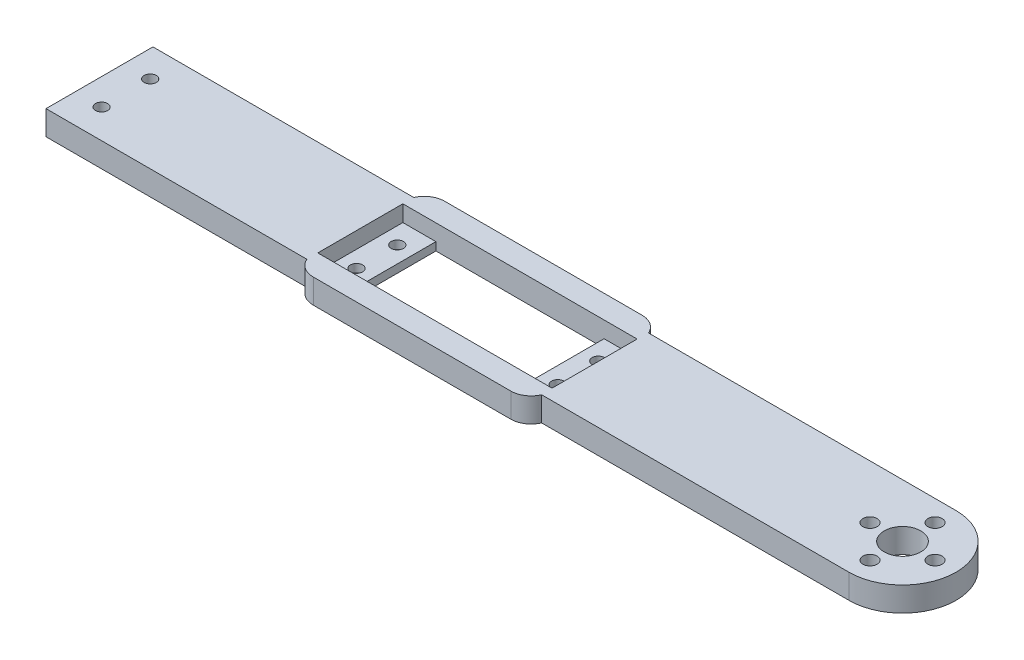
from build123d import *

# Parameters (mm, degrees)
SKETCH1_W            = 57.629592668
SKETCH1_H            = 21.211867522
SKETCH1_R            = 1.75
SKETCH1_R_2          = 4.5
BOSS_EXTRUDE1_DEPTH  = 6
SKETCH1_22_W         = 8.129592668
SKETCH1_22_H         = 21.211867522
SKETCH1_22_R         = 1.5
BOSS_EXTRUDE2_DEPTH  = 2
SKETCH4_W            = 57.748953374
SKETCH4_H            = 6
BOSS_EXTRUDE4_DEPTH  = 3
FILLET2_R            = 5
FILLET2_OF_MIRROR1_R = 5
SKETCH8_R            = 1.5
CUT_EXTRUDE4_DEPTH   = 13


with BuildPart() as part:
    # Sketch1 → Boss-Extrude1 (new body)
    with BuildSketch(Plane(origin=(0, 0, 0), x_dir=(1, 0, 0), z_dir=(0, 1, 0))):
        with BuildLine():
            Line((-197.556308439, -13.154372872), (0, -13.154372872))
            ThreePointArc((0, -13.154372872), (13.154372872, 0), (0, 13.154372872))
            Line((0, 13.154372872), (-197.556308439, 13.154372872))
            Line((-197.556308439, 13.154372872), (-197.556308439, -13.154372872))
        make_face()
        with Locations((-104.57172107, -0.139435446)):
            Rectangle(SKETCH1_W, SKETCH1_H, mode=Mode.SUBTRACT)
        with Locations(Location((0, 8, 0), (0, 0, 270))):
            Circle(SKETCH1_R, mode=Mode.SUBTRACT)
        with Locations(Location((0, -8, 0), (0, 0, 270))):
            Circle(SKETCH1_R, mode=Mode.SUBTRACT)
        with Locations(Location((-8, 0, 0), (0, 0, 270))):
            Circle(SKETCH1_R, mode=Mode.SUBTRACT)
        with Locations(Location((0, 0, 0), (0, 0, 270))):
            Circle(SKETCH1_R_2, mode=Mode.SUBTRACT)
        with Locations(Location((8, 0, 0), (0, 0, 270))):
            Circle(SKETCH1_R, mode=Mode.SUBTRACT)
    boss_extrude1 = extrude(amount=BOSS_EXTRUDE1_DEPTH)

    # Sketch1<22> → Boss-Extrude2 (add)
    # profile 1 of 2: a face of its own
    with BuildSketch(Plane(origin=(0, 0, 0), x_dir=(1, 0, 0), z_dir=(0, 1, 0))):
        with Locations((-129.32172107, -0.139435446)):
            Rectangle(SKETCH1_22_W, SKETCH1_22_H)
        with Locations(Location((-129.32172107, -5, 0), (0, 0, 270))):
            Circle(SKETCH1_22_R, mode=Mode.SUBTRACT)
        with Locations(Location((-129.29672107, 5, 0), (0, 0, 270))):
            Circle(SKETCH1_22_R, mode=Mode.SUBTRACT)
    # profile 2 of 2: a face of its own
    with BuildSketch(Plane(origin=(0, 0, 0), x_dir=(1, 0, 0), z_dir=(0, 1, 0))):
        with Locations((-79.82172107, -0.139435446)):
            Rectangle(SKETCH1_22_W, SKETCH1_22_H)
        with Locations(Location((-79.82172107, -5, 0), (0, 0, 270))):
            Circle(SKETCH1_22_R, mode=Mode.SUBTRACT)
        with Locations(Location((-79.84672107, 5, 0), (0, 0, 270))):
            Circle(SKETCH1_22_R, mode=Mode.SUBTRACT)
    extrude(amount=BOSS_EXTRUDE2_DEPTH)

    # Sketch4 → Boss-Extrude4 (add)
    with BuildSketch(Plane.XY.offset(13.154372872)):
        with Locations((-104.509525291, 3)):
            Rectangle(SKETCH4_W, SKETCH4_H)
    boss_extrude4 = extrude(amount=BOSS_EXTRUDE4_DEPTH)

    # Fillet2
    # the kernel refuses this fillet: 5 mm, written as the material it takes off along each edge
    with BuildSketch(Plane(origin=(-75.635048604, -11.456439237, 16.154372872), x_dir=(0, 0, -1), z_dir=(0, 1, 0)), Plane(origin=(-133.384001978, 17.456439237, 16.154372872), x_dir=(0, 0, -1), z_dir=(0, -1, 0))) as fillet2_piece_1:
        with BuildLine():
            CenterArc((5, 4.582575695), FILLET2_R, 180, 66.421821522)
            Line((0, 4.582575695), (-0.1, 4.582575695))
            Line((-0.1, 4.582575695), (-0.1, 0))
            Line((-0.1, 0), (0, -0.1))
            ThreePointArc((0, -0.1), (1.5, -0.1), (2.96, -0.091651514))
            Line((2.96, -0.091651514), (3, 0))
        make_face()
    extrude(amount=28.912878475, mode=Mode.SUBTRACT)

    # Mirror1: Boss-Extrude1, Boss-Extrude4 across plane
    add(boss_extrude1.mirror(Plane(origin=(0, 0, 0), x_dir=(1, 0, 0), z_dir=(0, 0, -1))))
    add(boss_extrude4.mirror(Plane(origin=(0, 0, 0), x_dir=(1, 0, 0), z_dir=(0, 0, -1))))

    # Fillet2 of Mirror1
    # the kernel refuses this fillet: 5 mm, written as the material it takes off along each edge
    with BuildSketch(Plane(origin=(-75.635048604, -11.456439237, -16.154372872), x_dir=(0, 0, 1), z_dir=(0, 1, 0))) as fillet2_of_mirror1_piece_1:
        with BuildLine():
            CenterArc((5, -4.582575695), FILLET2_OF_MIRROR1_R, 113.578178478, 66.421821522)
            Line((0, -4.582575695), (-0.1, -4.582575695))
            Line((-0.1, -4.582575695), (-0.1, 0))
            Line((-0.1, 0), (0, 0.1))
            ThreePointArc((0, 0.1), (1.5, 0.1), (2.96, 0.091651514))
            Line((2.96, 0.091651514), (3, 0))
        make_face()
    extrude(amount=28.912878475, mode=Mode.SUBTRACT)
    with BuildSketch(Plane(origin=(-133.384001978, 17.456439237, -16.154372872), x_dir=(1, 0, 0), z_dir=(0, -1, 0))) as fillet2_of_mirror1_piece_2:
        with BuildLine():
            CenterArc((4.582575695, 5), FILLET2_OF_MIRROR1_R, 203.578178478, 66.421821522)
            Line((0, 3), (-0.091651514, 2.96))
            ThreePointArc((-0.091651514, 2.96), (-0.1, 1.5), (-0.1, 0))
            Line((-0.1, 0), (0, -0.1))
            Line((0, -0.1), (4.582575695, -0.1))
            Line((4.582575695, -0.1), (4.582575695, 0))
        make_face()
    extrude(amount=28.912878475, mode=Mode.SUBTRACT)

    # Sketch8 → Cut-Extrude4 (cut)
    with BuildSketch(Plane(origin=(0, 6, 0), x_dir=(1, 0, 0), z_dir=(0, 1, 0))):
        with Locations(Location((-191.056308439, -5.984372872, 0), (0, 0, 270))):
            Circle(SKETCH8_R)
        with Locations(Location((-191.056308439, 5.984372872, 0), (0, 0, 270))):
            Circle(SKETCH8_R)
    extrude(amount=-CUT_EXTRUDE4_DEPTH, mode=Mode.SUBTRACT)


solid = part.part
